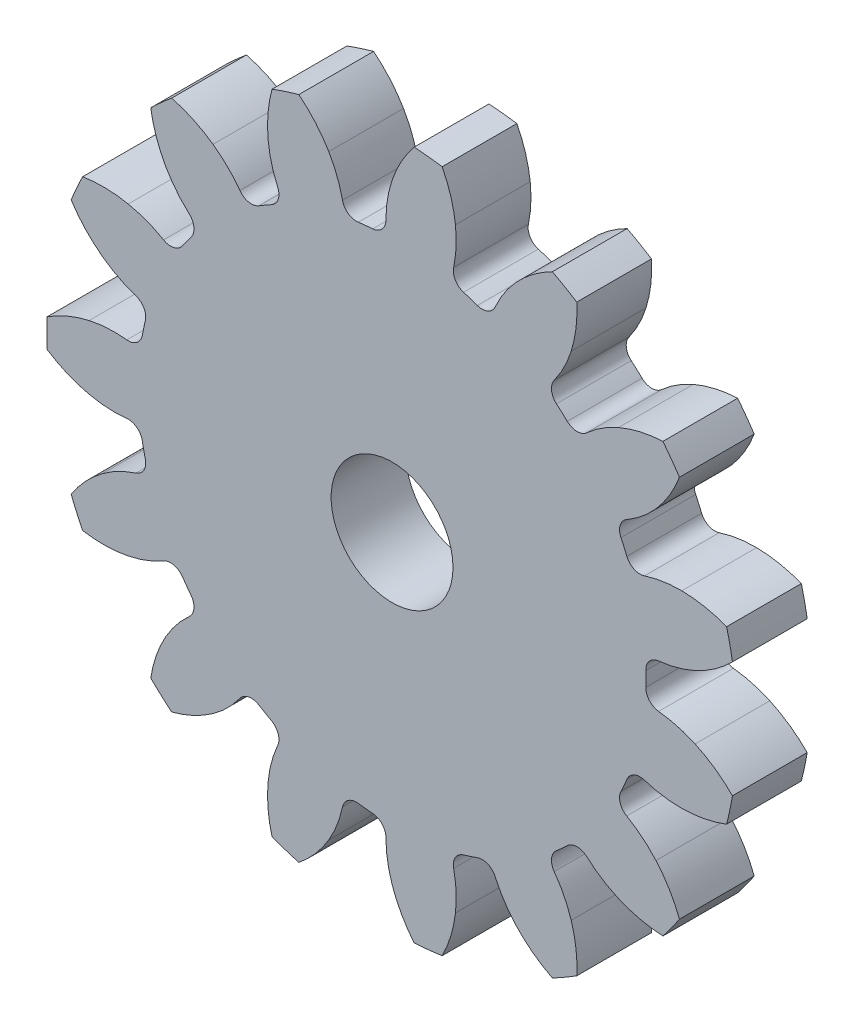
from build123d import *

# Parameters (mm, degrees)
SKETCH1_R        = 26.9875
GEAR_BASE_DEPTH  = 2.921
GEAR_CUT_DEPTH   = 39.610610931
GEAR_TEETH_COUNT = 15
SKETCH3_R        = 4.7625
BORE_DEPTH       = 39.572118529


with BuildPart() as part:
    # Sketch1 → GEAR_BASE (new, symmetric)
    with BuildSketch(Plane.XY):
        Circle(SKETCH1_R)
    extrude(amount=GEAR_BASE_DEPTH, both=True)

    # Sketch2 → GEAR_CUT (cut, through all)
    with BuildSketch(Plane.XY.offset(2.921)):
        with BuildLine():
            ThreePointArc((-25.081599898, -9.961852378), (-26.397758375, -5.611016756), (-26.965032052, -1.101000756))
            ThreePointArc((-26.965032052, -1.101000756), (-25.386045792, -1.945419828), (-23.681539378, -2.4939625))
            ThreePointArc((-23.681539378, -2.4939625), (-22.214193273, -2.699568669), (-20.732987425, -2.662049009))
            ThreePointArc((-20.732987425, -2.662049009), (-19.948924355, -2.876360551), (-19.520504813, -3.567114509))
            ThreePointArc((-19.520504813, -3.567114509), (-19.410116452, -4.125747615), (-19.283744683, -4.680983342))
            ThreePointArc((-19.283744683, -4.680983342), (-19.394170464, -5.486272409), (-20.023279363, -6.000962926))
            ThreePointArc((-20.023279363, -6.000962926), (-21.391688858, -6.569147705), (-22.648548664, -7.353801716))
            ThreePointArc((-22.648548664, -7.353801716), (-23.982580351, -8.5482056), (-25.081599898, -9.961852378))
        make_face()
    gear_cut = extrude(amount=-GEAR_CUT_DEPTH, mode=Mode.SUBTRACT)

    # GEAR_TEETH: GEAR_CUT ×15 about axis
    gear_teeth_axis = Axis((0, 0, -3.2131), (0, 0, 1))
    for i in range(1, GEAR_TEETH_COUNT):
        add(gear_cut.rotate(gear_teeth_axis, i * 360 / GEAR_TEETH_COUNT), mode=Mode.SUBTRACT)

    # Sketch3 → BORE (cut, through all)
    with BuildSketch(Plane.XY.offset(2.921)):
        Circle(SKETCH3_R)
    extrude(amount=-BORE_DEPTH, mode=Mode.SUBTRACT)


solid = part.part
